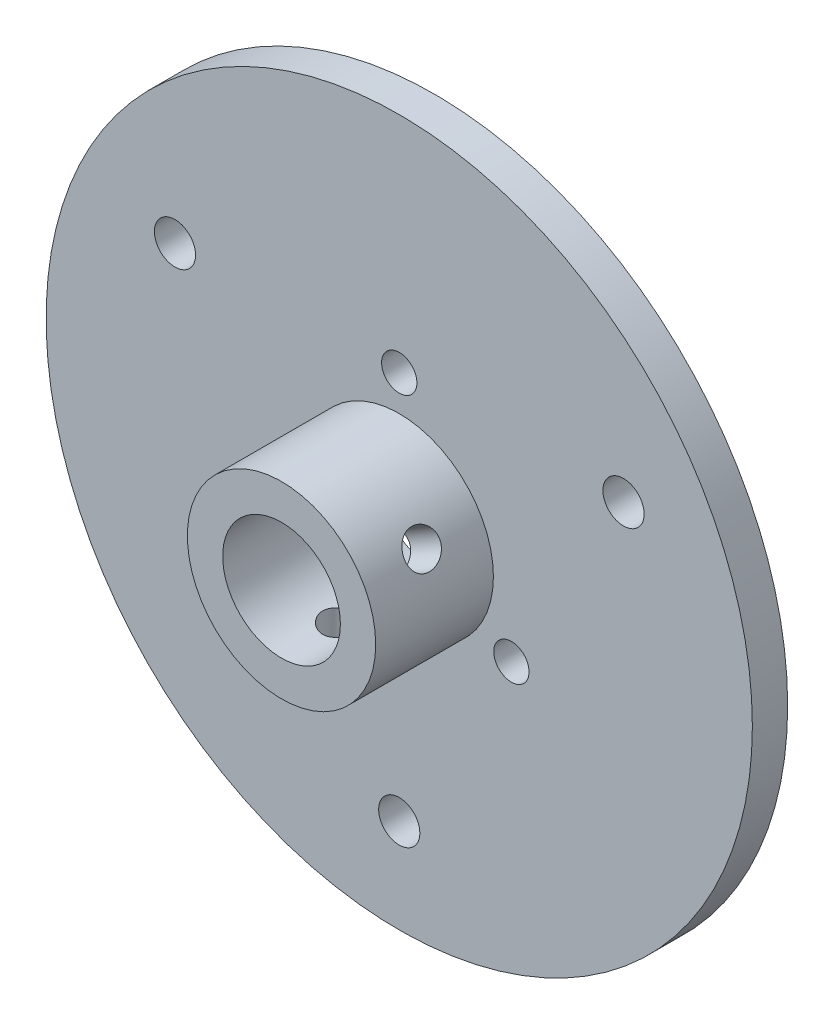
from build123d import *

# Parameters (mm, degrees)
SKETCH2_R           = 30
SKETCH2_R_2         = 5
SKETCH2_R_3         = 1.75
BOSS_EXTRUDE1_DEPTH = 3
SKETCH3_R           = 8
SKETCH3_R_2         = 5
BOSS_EXTRUDE2_DEPTH = 10
SKETCH4_R           = 1.5
CUT_EXTRUDE2_DEPTH  = 44.588989435
SKETCH12_R          = 1.5
CUT_EXTRUDE3_DEPTH  = 11.49377522
CIRPATTERN1_COUNT   = 3


with BuildPart() as part:
    # Sketch2 → Boss-Extrude1 (new body)
    with BuildSketch(Plane.XY):
        Circle(SKETCH2_R)
        Circle(SKETCH2_R_2, mode=Mode.SUBTRACT)
        with Locations((0, -22)):
            Circle(SKETCH2_R_3, mode=Mode.SUBTRACT)
        with Locations((-19.052558883, 11)):
            Circle(SKETCH2_R_3, mode=Mode.SUBTRACT)
        with Locations((19.052558883, 11)):
            Circle(SKETCH2_R_3, mode=Mode.SUBTRACT)
    extrude(amount=BOSS_EXTRUDE1_DEPTH)

    # Sketch3 → Boss-Extrude2 (add)
    with BuildSketch(Plane.XY.offset(3)):
        Circle(SKETCH3_R)
        Circle(SKETCH3_R_2, mode=Mode.SUBTRACT)
    extrude(amount=BOSS_EXTRUDE2_DEPTH)

    # Sketch4 → Cut-Extrude2 (cut, through all)
    with BuildSketch(Plane.XY.offset(3)):
        with Locations((0, 11)):
            Circle(SKETCH4_R)
        with Locations((9.526279442, -5.5)):
            Circle(SKETCH4_R)
        with Locations((-9.526279442, -5.5)):
            Circle(SKETCH4_R)
    extrude(amount=-CUT_EXTRUDE2_DEPTH, mode=Mode.SUBTRACT)

    # Sketch12 → Cut-Extrude3 (cut)
    with BuildSketch(Plane(origin=(0, 0, 0), x_dir=(1, 0, 0), z_dir=(0, 1, 0))):
        with Locations((0, -8)):
            Circle(SKETCH12_R)
    cut_extrude3 = extrude(amount=-CUT_EXTRUDE3_DEPTH, mode=Mode.SUBTRACT)

    # CirPattern1: Cut-Extrude3 ×3 about axis
    cirpattern1_axis = Axis((0, 0, 13), (0, 0, 1))
    for i in range(1, CIRPATTERN1_COUNT):
        add(cut_extrude3.rotate(cirpattern1_axis, i * 360 / CIRPATTERN1_COUNT), mode=Mode.SUBTRACT)


solid = part.part
